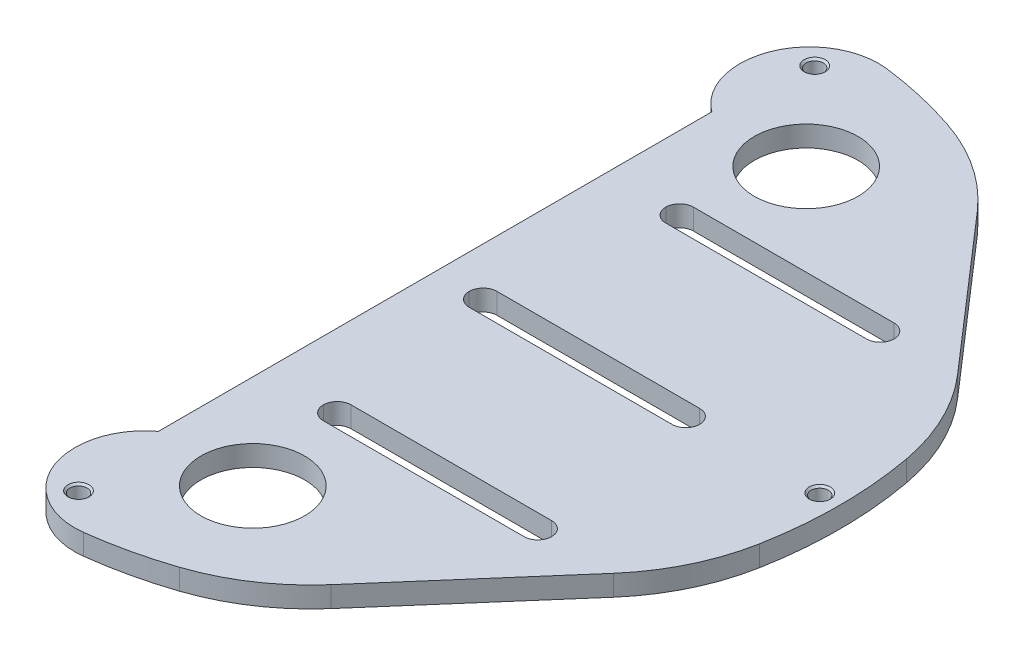
from build123d import *

# Parameters (mm, degrees)
EXTRUDE_1_DEPTH              = 3
FILLET_1_R                   = 10
SKETCH_2_W                   = 33
SKETCH_2_H                   = 4
SKETCH_2_W_2                 = 33.308993126
CUT_EXTRUDE_1_DEPTH          = 83.523019213
SKETCH_3_W                   = 8
SKETCH_3_H                   = 80
CUT_EXTRUDE_2_DEPTH          = 83.523019213
FILLET_2_R                   = 10
FILLET_3_R                   = 2
CUT_EXTRUDE_3_DEPTH          = 83.523019213
FILLET_4_R                   = 30
SKETCH_5_R                   = 7.5
CUT_EXTRUDE_4_DEPTH          = 83.523019213
HOLE_WIZARD_M3_1_D           = 2.5
HOLE_WIZARD_M3_1_DEPTH       = 3
HOLE_WIZARD_M3_1_CSINK_D     = 3.05
HOLE_WIZARD_M3_1_CSINK_ANGLE = 90
HOLE_WIZARD_M3_1_TIP         = 0.751075774


# Some blends are built 0.0001 mm under size
with BuildPart() as part:
    # 草图1 → 凸台-拉伸1 (new body)
    with BuildSketch(Plane(origin=(0, 0, 0), x_dir=(1, 0, 0), z_dir=(0, 1, 0))):
        with BuildLine():
            Line((-4, 58.36308765), (-4, -58.36308765))
            ThreePointArc((-4, -58.36308765), (58.5, 0), (-4, 58.36308765))
        make_face()
    extrude(amount=EXTRUDE_1_DEPTH)

    # 圆角1
    fillet_1_edges = [part.edges().sort_by_distance(p)[0] for p in [
        (-4, 1.5, 58.36308765),
        (-4, 1.5, -58.36308765),
    ]]
    fillet(fillet_1_edges, radius=FILLET_1_R)

    # 草图2 → 切除-拉伸1 (cut, through all)
    with BuildSketch(Plane.XZ):
        with Locations((25.103538951, 24.75)):
            Rectangle(SKETCH_2_W, SKETCH_2_H)
        with Locations((25.103538951, -24.75)):
            Rectangle(SKETCH_2_W, SKETCH_2_H)
        with Locations((21.59426648, 0)):
            Rectangle(SKETCH_2_W_2, SKETCH_2_H)
    extrude(amount=-CUT_EXTRUDE_1_DEPTH, mode=Mode.SUBTRACT)

    # 草图3 → 切除-拉伸2 (cut, through all)
    with BuildSketch(Plane.XZ):
        with Locations((-4, 0)):
            Rectangle(SKETCH_3_W, SKETCH_3_H)
    extrude(amount=-CUT_EXTRUDE_2_DEPTH, mode=Mode.SUBTRACT)

    # 圆角2
    # the kernel refuses this fillet: 10 mm, written as the material it takes off along each edge
    with BuildSketch(Plane(origin=(-4, 23, 40), x_dir=(0, 0, 1), z_dir=(0, -1, 0)), Plane(origin=(-4, -20, -40), x_dir=(0, 0, -1), z_dir=(0, 1, 0))) as fillet_2_piece_1:
        with BuildLine():
            CenterArc((8, -10), FILLET_2_R, 90, 53.130102354)
            Line((0, -4), (-0.16, -3.88))
            ThreePointArc((-0.16, -3.88), (-0.2, -2), (-0.2, 0))
            Line((-0.2, 0), (0, 0.2))
            Line((0, 0.2), (8, 0.2))
            Line((8, 0.2), (8, 0))
        make_face()
    extrude(amount=43, mode=Mode.SUBTRACT)

    # 圆角3
    fillet_3_edges = [part.edges().sort_by_distance(p)[0] for p in [
        (8.603538951, 1.5, -26.75),
        (8.603538951, 1.5, -22.75),
        (41.603538951, 1.5, -26.75),
        (41.603538951, 1.5, -22.75),
        (4.939769917, 1.5, 2),
        (38.248763043, 1.5, 2),
        (38.248763043, 1.5, -2),
        (4.939769917, 1.5, -2),
        (41.603538951, 1.5, 22.75),
        (41.603538951, 1.5, 26.75),
        (8.603538951, 1.5, 22.75),
        (8.603538951, 1.5, 26.75),
    ]]
    fillet(fillet_3_edges, radius=FILLET_3_R - 0.0001)  # a hair under: the kernel refuses the full size

    # 草图4 → 切除-拉伸3 (cut, through all)
    with BuildSketch(Plane(origin=(0, 3, 0), x_dir=(1, 0, 0), z_dir=(0, 1, 0))):
        with BuildLine():
            Line((55.026651821, -19.857431591), (27.299740921, -51.73948343))
            ThreePointArc((27.299740921, -51.73948343), (44.142100571, -38.389125506), (55.026651821, -19.857431591))
        make_face()
        with BuildLine():
            Line((55.026651821, 19.857431591), (27.299740921, 51.73948343))
            ThreePointArc((27.299740921, 51.73948343), (44.142100571, 38.389125506), (55.026651821, 19.857431591))
        make_face()
    extrude(amount=-CUT_EXTRUDE_3_DEPTH, mode=Mode.SUBTRACT)

    # 圆角4
    fillet_4_edges = [part.edges().sort_by_distance(p)[0] for p in [
        (55.026651821, 1.5, 19.857431591),
        (27.299740921, 1.5, 51.73948343),
        (27.299740921, 1.5, -51.73948343),
        (55.026651821, 1.5, -19.857431591),
    ]]
    fillet(fillet_4_edges, radius=FILLET_4_R)

    # 草图5 → 切除-拉伸4 (cut, through all)
    with BuildSketch(Plane(origin=(0, 3, 0), x_dir=(1, 0, 0), z_dir=(0, 1, 0))):
        with Locations(Location((13.650269614, 40, 0), (0, 0, 270))):
            Circle(SKETCH_5_R)
        with Locations(Location((13.650269614, -40, 0), (0, 0, 270))):
            Circle(SKETCH_5_R)
    extrude(amount=-CUT_EXTRUDE_4_DEPTH, mode=Mode.SUBTRACT)

    # M3 螺纹孔1
    with Locations(Plane(origin=(0, 3, 0), x_dir=(1, 0, 0), z_dir=(0, 1, 0))):
        with Locations((1.668639438, 53.213363577), (1.668639438, -53.213363577), (0.79229906, -68.463573452), (55.526064592, 0.086594156)):
            CounterSinkHole(HOLE_WIZARD_M3_1_D / 2, HOLE_WIZARD_M3_1_CSINK_D / 2, depth=HOLE_WIZARD_M3_1_DEPTH, counter_sink_angle=HOLE_WIZARD_M3_1_CSINK_ANGLE)
            with Locations((0, 0, -(HOLE_WIZARD_M3_1_DEPTH + HOLE_WIZARD_M3_1_TIP / 2))):  # 118° drill point
                Cone(0, HOLE_WIZARD_M3_1_D / 2, HOLE_WIZARD_M3_1_TIP, mode=Mode.SUBTRACT)


solid = part.part
